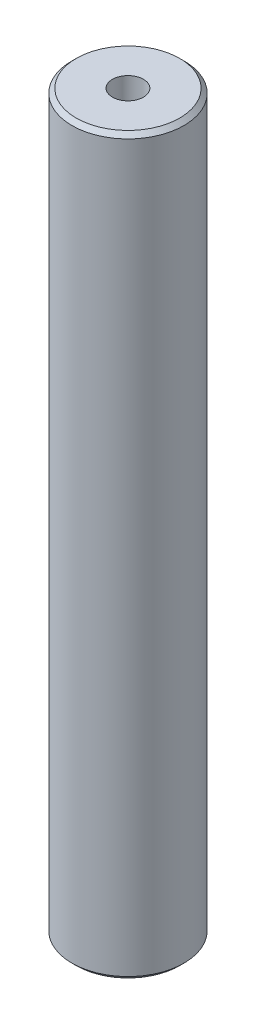
from build123d import *

# Parameters (mm, degrees)
SKETCH1_R           = 15
BOSS_EXTRUDE1_DEPTH = 196.479799854
SKETCH2_R           = 4.150337845
CUT_EXTRUDE1_DEPTH  = 198.621637861
CHAMFER1_SIZE       = 1.154054127


with BuildPart() as part:
    # Sketch1 → Boss-Extrude1 (new body)
    with BuildSketch(Plane(origin=(0, 0, 0), x_dir=(1, 0, 0), z_dir=(0, 1, 0))):
        Circle(SKETCH1_R)
    extrude(amount=BOSS_EXTRUDE1_DEPTH)

    # Sketch2 → Cut-Extrude1 (cut, through all)
    with BuildSketch(Plane(origin=(0, 0, 0), x_dir=(1, 0, 0), z_dir=(0, 1, 0))):
        Circle(SKETCH2_R)
    extrude(amount=CUT_EXTRUDE1_DEPTH, mode=Mode.SUBTRACT)

    # Chamfer1
    chamfer1_edges = [part.edges().sort_by_distance(p)[0] for p in [
        (-15, 196.479799854, 0),
        (-15, 0, 0),
    ]]
    chamfer(chamfer1_edges, length=CHAMFER1_SIZE)


solid = part.part
